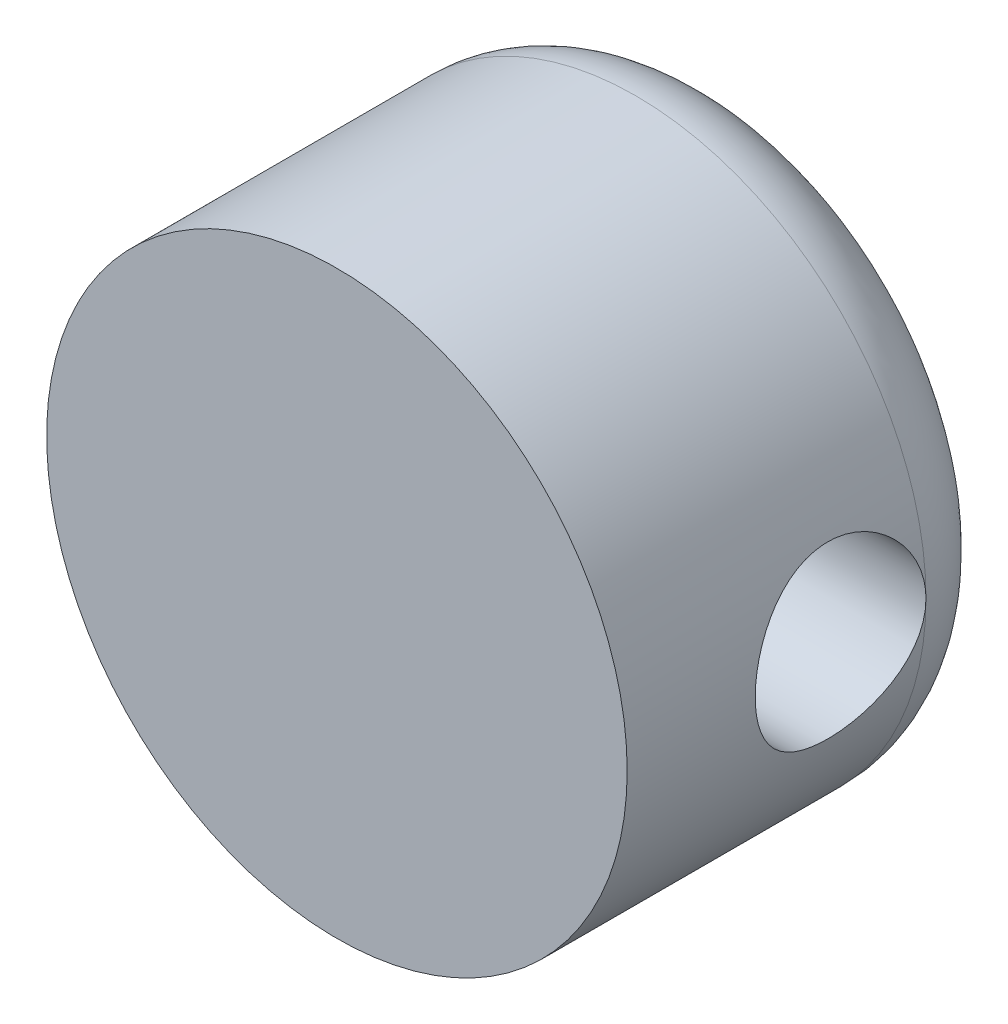
from build123d import *

# Parameters (mm, degrees)
SKETCH1_R           = 3.4
BOSS_EXTRUDE1_DEPTH = 4.5
SKETCH2_R           = 1
CUT_EXTRUDE1_DEPTH  = 10
FILLET1_R           = 1


with BuildPart() as part:
    # Sketch1 → Boss-Extrude1 (new body)
    with BuildSketch(Plane.XY):
        Circle(SKETCH1_R)
    extrude(amount=BOSS_EXTRUDE1_DEPTH)

    # Sketch2 → Cut-Extrude1 (cut)
    with BuildSketch(Plane(origin=(4, 0, 0), x_dir=(0, 0, -1), z_dir=(1, 0, 0))):
        with Locations(Location((-2, 0, 0), (0, 0, 180))):
            Circle(SKETCH2_R)
    extrude(amount=-CUT_EXTRUDE1_DEPTH, mode=Mode.SUBTRACT)

    # Fillet1
    fillet1_edges = [part.edges().sort_by_distance(p)[0] for p in [
        (-3.4, 0, 0),
    ]]
    fillet(fillet1_edges, radius=FILLET1_R - 0.0001)  # a hair under: the kernel refuses the full size


solid = part.part
